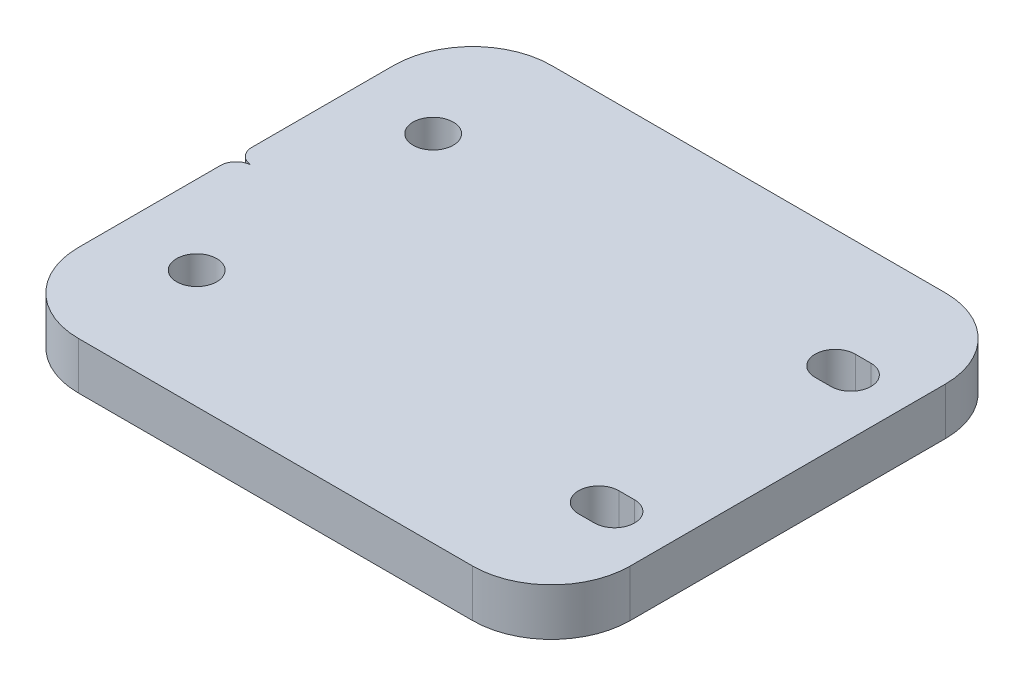
from build123d import *

# Parameters (mm, degrees)
EXTRUDE_1_DEPTH     = 6
SKETCH_2_R          = 2.55
CUT_EXTRUDE_1_DEPTH = 47.486557197
CUT_EXTRUDE_2_DEPTH = 47.486557197


with BuildPart() as part:
    # Эскиз1 → Бобышка-Вытянуть1 (new body)
    with BuildSketch(Plane(origin=(0, 0, 0), x_dir=(1, 0, 0), z_dir=(0, 1, 0))):
        with BuildLine():
            Line((-25, -30), (25, -30))
            ThreePointArc((25, -30), (32.071067812, -27.071067812), (35, -20))
            Line((35, -20), (35, 20))
            ThreePointArc((35, 20), (32.071067812, 27.071067812), (25, 30))
            Line((25, 30), (-25, 30))
            ThreePointArc((-25, 30), (-32.071067812, 27.071067812), (-35, 20))
            Line((-35, 20), (-35, -20))
            ThreePointArc((-35, -20), (-32.071067812, -27.071067812), (-25, -30))
        make_face()
    extrude(amount=EXTRUDE_1_DEPTH)

    # Эскиз2 → Вырез-Вытянуть1 (cut, through all)
    with BuildSketch(Plane.XZ):
        with Locations((-25, -15)):
            Circle(SKETCH_2_R)
        with Locations((-25, 15)):
            Circle(SKETCH_2_R)
        with BuildLine():
            Line((28, -17.55), (26, -17.55))
            ThreePointArc((26, -17.55), (23.45, -15), (26, -12.45))
            Line((26, -12.45), (28, -12.45))
            ThreePointArc((28, -12.45), (30.55, -15), (28, -17.55))
        make_face()
        with BuildLine():
            Line((28, 17.55), (26, 17.55))
            ThreePointArc((26, 17.55), (23.45, 15), (26, 12.45))
            Line((26, 12.45), (28, 12.45))
            ThreePointArc((28, 12.45), (30.55, 15), (28, 17.55))
        make_face()
    extrude(amount=-CUT_EXTRUDE_1_DEPTH, mode=Mode.SUBTRACT)

    # Эскиз3 → Вырез-Вытянуть2 (cut, through all)
    with BuildSketch(Plane.XZ):
        with BuildLine():
            Line((-35, -2), (-35, 2))
            ThreePointArc((-35, 2), (-34.414213562, 0.585786438), (-33, 0))
            ThreePointArc((-33, 0), (-34.414213562, -0.585786438), (-35, -2))
        make_face()
    extrude(amount=-CUT_EXTRUDE_2_DEPTH, mode=Mode.SUBTRACT)


solid = part.part
